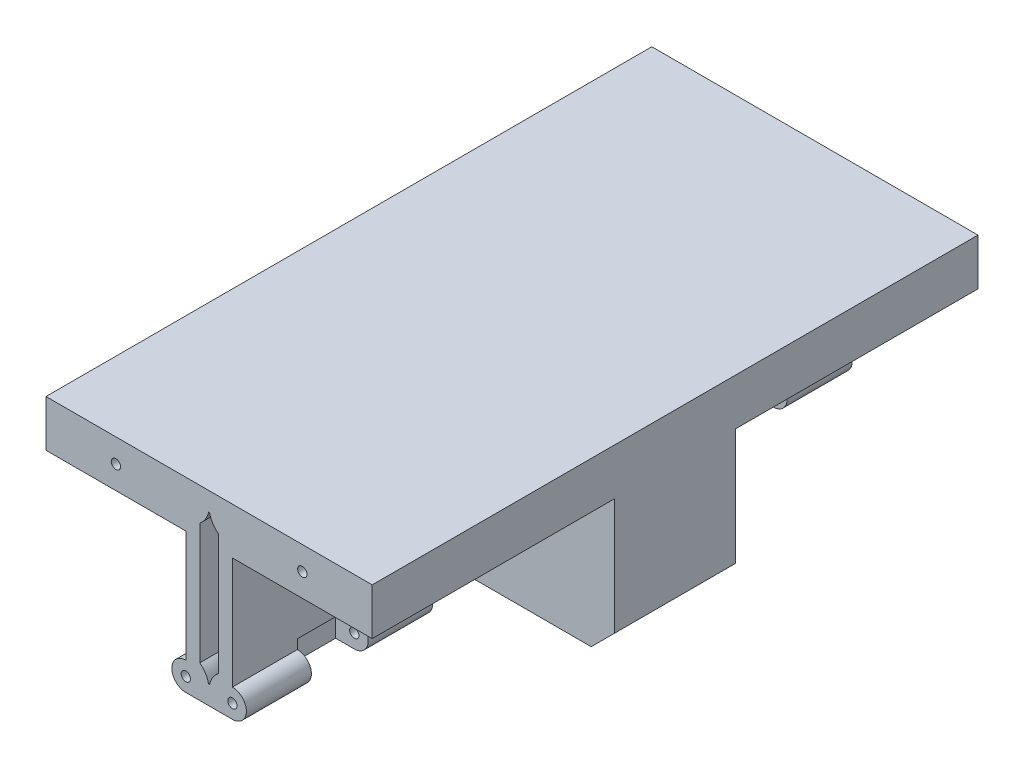
from build123d import *

# Parameters (mm, degrees)
SKETCH_1_W               = 70
SKETCH_1_H               = 40
EXTRUDE_1_DEPTH          = 65
SKETCH_7_W               = 30
SKETCH_7_H               = 30
CUT_EXTRUDE_5_DEPTH      = 52
SKETCH_4_R               = 3
EXTRUDE_3_DEPTH          = 40
SKETCH_5_W               = 12.2
SKETCH_5_H               = 8
CUT_EXTRUDE_3_DEPTH      = 4
SKETCH_6_R               = 1
CUT_EXTRUDE_4_DEPTH      = 40
MIRROR_2_COPY_1_SKETCH_W = 30
MIRROR_2_COPY_1_SKETCH_H = 30
MIRROR_2_COPY_1_DEPTH    = 52
MIRROR_2_COPY_2_SKETCH_R = 3
MIRROR_2_COPY_2_DEPTH    = 40
MIRROR_2_COPY_3_SKETCH_W = 12.2
MIRROR_2_COPY_3_SKETCH_H = 8
MIRROR_2_COPY_3_DEPTH    = 4
MIRROR_2_COPY_4_SKETCH_R = 1
MIRROR_2_COPY_4_DEPTH    = 40
MIRROR_2_COPY_5_SKETCH_W = 30
MIRROR_2_COPY_5_SKETCH_H = 30
MIRROR_2_COPY_5_DEPTH    = 52
MIRROR_2_COPY_6_SKETCH_R = 3
MIRROR_2_COPY_6_DEPTH    = 40
MIRROR_2_COPY_7_SKETCH_W = 12.2
MIRROR_2_COPY_7_SKETCH_H = 8
MIRROR_2_COPY_7_DEPTH    = 4
MIRROR_2_COPY_8_SKETCH_R = 1
MIRROR_2_COPY_8_DEPTH    = 40
CUT_EXTRUDE_7_DEPTH      = 77.560896337
CUT_EXTRUDE_7_DEPTH_BACK = 77.560896337
CUT_EXTRUDE_8_REACH      = 89.867
SKETCH_13_R              = 1
CUT_EXTRUDE_11_DEPTH     = 40


with BuildPart() as part:
    # Эскиз1 → Бобышка-Вытянуть1 (new, symmetric)
    with BuildSketch(Plane.XY):
        with Locations((0, -0.287208972)):
            Rectangle(SKETCH_1_W, SKETCH_1_H)
    extrude(amount=EXTRUDE_1_DEPTH, both=True)

    # Эскиз7 → Вырез-Вытянуть5 (cut)
    with BuildSketch(Plane.XY.offset(65)):
        with Locations((-20, -5.287208972)):
            Rectangle(SKETCH_7_W, SKETCH_7_H)
    cut_extrude_5 = extrude(amount=-CUT_EXTRUDE_5_DEPTH, mode=Mode.SUBTRACT)

    # Эскиз4 → Бобышка-Вытянуть3 (add)
    with BuildSketch(Plane.XY.offset(65)):
        with Locations((-5, -17.287208972)):
            Circle(SKETCH_4_R)
    extrude_3 = extrude(amount=-EXTRUDE_3_DEPTH)

    # Эскиз5 → Вырез-Вытянуть3 (cut, symmetric)
    with BuildSketch(Plane.ZY.offset(5)):
        with Locations((44.95, -16.287208972)):
            Rectangle(SKETCH_5_W, SKETCH_5_H)
    cut_extrude_3 = extrude(amount=CUT_EXTRUDE_3_DEPTH, both=True, mode=Mode.SUBTRACT)

    # Эскиз6 → Вырез-Вытянуть4 (cut)
    with BuildSketch(Plane.XY.offset(65)):
        with Locations((-5, -17.287208972)):
            Circle(SKETCH_6_R)
    cut_extrude_4 = extrude(amount=-CUT_EXTRUDE_4_DEPTH, mode=Mode.SUBTRACT)

    # Зеркальное отражение1: Вырез-Вытянуть5, Бобышка-Вытянуть3, Вырез-Вытянуть3, Вырез-Вытянуть4 across plane
    add(cut_extrude_5.mirror(Plane.XY), mode=Mode.SUBTRACT)
    add(extrude_3.mirror(Plane.XY))
    add(cut_extrude_3.mirror(Plane.XY), mode=Mode.SUBTRACT)
    add(cut_extrude_4.mirror(Plane.XY), mode=Mode.SUBTRACT)

    # Зеркальное отражение2 copy 1 sketch → Зеркальное отражение2 copy 1 (cut)
    with BuildSketch(Plane(origin=(0, 0, -65), x_dir=(-1, 0, 0), z_dir=(0, 0, -1))):
        with Locations((-20, -5.287208972)):
            Rectangle(MIRROR_2_COPY_1_SKETCH_W, MIRROR_2_COPY_1_SKETCH_H)
    extrude(amount=-MIRROR_2_COPY_1_DEPTH, mode=Mode.SUBTRACT)

    # Зеркальное отражение2 copy 2 sketch → Зеркальное отражение2 copy 2 (add)
    with BuildSketch(Plane(origin=(0, 0, -65), x_dir=(-1, 0, 0), z_dir=(0, 0, -1))):
        with Locations((-5, -17.287208972)):
            Circle(MIRROR_2_COPY_2_SKETCH_R)
    extrude(amount=-MIRROR_2_COPY_2_DEPTH)

    # Зеркальное отражение2 copy 3 sketch → Зеркальное отражение2 copy 3 (cut, symmetric)
    with BuildSketch(Plane(origin=(5, 0, 0), x_dir=(0, 0, -1), z_dir=(1, 0, 0))):
        with Locations((44.95, -16.287208972)):
            Rectangle(MIRROR_2_COPY_3_SKETCH_W, MIRROR_2_COPY_3_SKETCH_H)
    extrude(amount=MIRROR_2_COPY_3_DEPTH, both=True, mode=Mode.SUBTRACT)

    # Зеркальное отражение2 copy 4 sketch → Зеркальное отражение2 copy 4 (cut)
    with BuildSketch(Plane(origin=(0, 0, -65), x_dir=(-1, 0, 0), z_dir=(0, 0, -1))):
        with Locations((-5, -17.287208972)):
            Circle(MIRROR_2_COPY_4_SKETCH_R)
    extrude(amount=-MIRROR_2_COPY_4_DEPTH, mode=Mode.SUBTRACT)

    # Зеркальное отражение2 copy 5 sketch → Зеркальное отражение2 copy 5 (cut)
    with BuildSketch(Plane(origin=(0, 0, 65), x_dir=(-1, 0, 0), z_dir=(0, 0, 1))):
        with Locations((-20, 5.287208972)):
            Rectangle(MIRROR_2_COPY_5_SKETCH_W, MIRROR_2_COPY_5_SKETCH_H)
    extrude(amount=-MIRROR_2_COPY_5_DEPTH, mode=Mode.SUBTRACT)

    # Зеркальное отражение2 copy 6 sketch → Зеркальное отражение2 copy 6 (add)
    with BuildSketch(Plane(origin=(0, 0, 65), x_dir=(-1, 0, 0), z_dir=(0, 0, 1))):
        with Locations((-5, 17.287208972)):
            Circle(MIRROR_2_COPY_6_SKETCH_R)
    extrude(amount=-MIRROR_2_COPY_6_DEPTH)

    # Зеркальное отражение2 copy 7 sketch → Зеркальное отражение2 copy 7 (cut, symmetric)
    with BuildSketch(Plane(origin=(5, 0, 0), x_dir=(0, 0, 1), z_dir=(1, 0, 0))):
        with Locations((44.95, 16.287208972)):
            Rectangle(MIRROR_2_COPY_7_SKETCH_W, MIRROR_2_COPY_7_SKETCH_H)
    extrude(amount=MIRROR_2_COPY_7_DEPTH, both=True, mode=Mode.SUBTRACT)

    # Зеркальное отражение2 copy 8 sketch → Зеркальное отражение2 copy 8 (cut)
    with BuildSketch(Plane(origin=(0, 0, 65), x_dir=(-1, 0, 0), z_dir=(0, 0, 1))):
        with Locations((-5, 17.287208972)):
            Circle(MIRROR_2_COPY_8_SKETCH_R)
    extrude(amount=-MIRROR_2_COPY_8_DEPTH, mode=Mode.SUBTRACT)

    # Эскиз9 → Вырез-Вытянуть7 (cut, two sides: drawn at the far end of the back side and taken through both)
    with BuildSketch(Plane.XY.offset(-CUT_EXTRUDE_7_DEPTH_BACK)):
        with BuildLine():
            Line((0.101020514, 15.712791028), (-0.101020514, 15.712791028))
            ThreePointArc((-0.101020514, 15.712791028), (-0.775255129, 14.038556414), (-2, 12.712791028))
            Line((-2, 12.712791028), (-2, -13.287208972))
            ThreePointArc((-2, -13.287208972), (-0.775255129, -14.612974358), (-0.101020514, -16.287208972))
            Line((-0.101020514, -16.287208972), (0.101020514, -16.287208972))
            ThreePointArc((0.101020514, -16.287208972), (0.775255129, -14.612974358), (2, -13.287208972))
            Line((2, -13.287208972), (2, 12.712791028))
            ThreePointArc((2, 12.712791028), (0.775255129, 14.038556414), (0.101020514, 15.712791028))
        make_face()
    extrude(amount=CUT_EXTRUDE_7_DEPTH + CUT_EXTRUDE_7_DEPTH_BACK, mode=Mode.SUBTRACT)

    # Эскиз10 → Вырез-Вытянуть8 (cut, up to next)
    with BuildSketch(Plane.XY.offset(13), mode=Mode.PRIVATE) as cut_extrude_8_sk1:
        Polygon((35, -15.287208972), (30, -20.287208972), (35, -20.287208972), align=None)
    cut_extrude_8_tool1 = extrude(cut_extrude_8_sk1.sketch, amount=-CUT_EXTRUDE_8_REACH, mode=Mode.PRIVATE) & part.part
    # Эскиз10 → Вырез-Вытянуть8 (cut, up to next)
    with BuildSketch(Plane.XY.offset(13), mode=Mode.PRIVATE) as cut_extrude_8_sk2:
        Polygon((-30, -20.287208972), (-35, -15.287208972), (-35, -20.287208972), align=None)
    cut_extrude_8_tool2 = extrude(cut_extrude_8_sk2.sketch, amount=-CUT_EXTRUDE_8_REACH, mode=Mode.PRIVATE) & part.part
    add(cut_extrude_8_tool1.solids().sort_by_distance((33.333333, -18.620542, 13))[0], mode=Mode.SUBTRACT)
    add(cut_extrude_8_tool2.solids().sort_by_distance((-33.333333, -18.620542, 13))[0], mode=Mode.SUBTRACT)

    # Эскиз13 → Вырез-Вытянуть11 (cut)
    with BuildSketch(Plane.XY.offset(65)):
        with Locations((-20, 14.652248637)):
            Circle(SKETCH_13_R)
        with Locations((20, 14.652248637)):
            Circle(SKETCH_13_R)
    cut_extrude_11 = extrude(amount=-CUT_EXTRUDE_11_DEPTH, mode=Mode.SUBTRACT)

    # Зеркальное отражение5: Вырез-Вытянуть11 across plane
    add(cut_extrude_11.mirror(Plane.XY), mode=Mode.SUBTRACT)


solid = part.part
